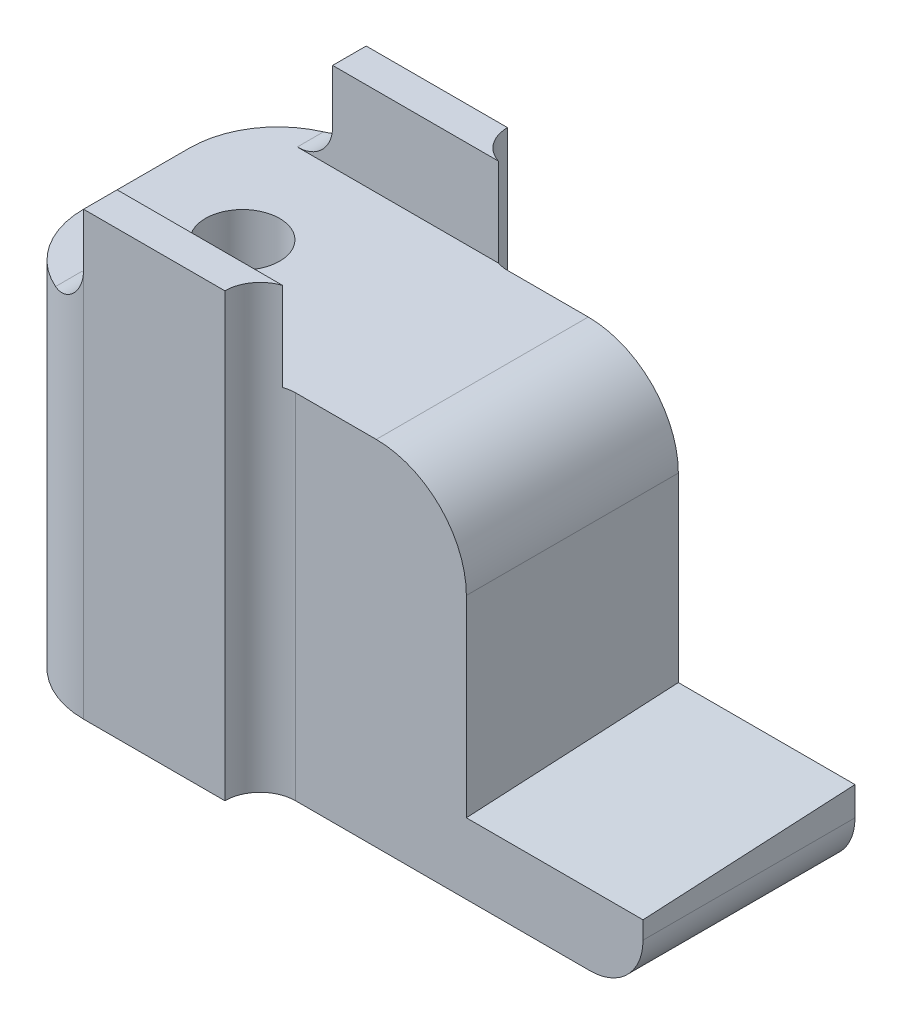
from build123d import *

# Parameters (mm, degrees)
SKETCH1_W           = 12
SKETCH1_H           = 16
SKETCH1_R           = 2.1
SKETCH1_W_2         = 1
BOSS_EXTRUDE1_DEPTH = 20
FILLET1_R           = 5
SKETCH2_W           = 8
SKETCH2_H           = 1.9
BOSS_EXTRUDE2_DEPTH = 5
SKETCH4_W           = 12
SKETCH4_H           = 20
BOSS_EXTRUDE3_DEPTH = 11.67
FILLET2_R           = 5.1
FILLET4_R           = 2
FILLET6_R           = 2
BOSS_EXTRUDE4_DEPTH = 10
FILLET7_R           = 3


with BuildPart() as part:
    # Sketch1 → Boss-Extrude1 (new body)
    # profile 1 of 2: a face of its own
    with BuildSketch(Plane(origin=(0, 0, 0), x_dir=(1, 0, 0), z_dir=(0, 1, 0))):
        Rectangle(SKETCH1_W, SKETCH1_H)
        with Locations(Location((0, 0, 0), (0, 0, 270))):
            Circle(SKETCH1_R, mode=Mode.SUBTRACT)
    # profile 2 of 2: a face of its own
    with BuildSketch(Plane(origin=(0, 0, 0), x_dir=(1, 0, 0), z_dir=(0, 1, 0))):
        with Locations((6.5, 0)):
            Rectangle(SKETCH1_W_2, SKETCH1_H)
    extrude(amount=BOSS_EXTRUDE1_DEPTH)

    # Fillet1
    fillet1_edges = [part.edges().sort_by_distance(p)[0] for p in [
        (-6, 10, 8),
        (-6, 10, -8),
    ]]
    fillet(fillet1_edges, radius=FILLET1_R)

    # Sketch2 → Boss-Extrude2 (add)
    with BuildSketch(Plane(origin=(0, 20, 0), x_dir=(1, 0, 0), z_dir=(0, 1, 0))):
        with Locations((3, 7.05)):
            Rectangle(SKETCH2_W, SKETCH2_H)
        with Locations((3, -7.05)):
            Rectangle(SKETCH2_W, SKETCH2_H)
    extrude(amount=BOSS_EXTRUDE2_DEPTH)

    # Sketch4 → Boss-Extrude3 (add)
    with BuildSketch(Plane(origin=(7, 0, 0), x_dir=(0, 0, -1), z_dir=(1, 0, 0))):
        with Locations((0, 10)):
            Rectangle(SKETCH4_W, SKETCH4_H)
    extrude(amount=BOSS_EXTRUDE3_DEPTH)

    # Fillet2
    fillet2_edges = [part.edges().sort_by_distance(p)[0] for p in [
        (18.67, 20, 0),
    ]]
    fillet(fillet2_edges, radius=FILLET2_R)

    # Fillet4
    fillet4_edges = [part.edges().sort_by_distance(p)[0] for p in [
        (-1, 20, -7.05),
        (-1, 20, 7.05),
    ]]
    fillet(fillet4_edges, radius=FILLET4_R)

    # Fillet6
    fillet6_edges = [part.edges().sort_by_distance(p)[0] for p in [
        (7, 10, -6),
        (7, 10, 6),
    ]]
    fillet(fillet6_edges, radius=FILLET6_R - 0.0001)  # a hair under: the kernel refuses the full size

    # Sketch5 → Boss-Extrude4 (add)
    with BuildSketch(Plane(origin=(18.67, 0, 0), x_dir=(0, 0, -1), z_dir=(1, 0, 0))):
        Polygon((-6, 4), (6, 4.628893351), (6, 0), (-6, 0), align=None)
    extrude(amount=BOSS_EXTRUDE4_DEPTH)

    # Fillet7
    fillet7_edges = [part.edges().sort_by_distance(p)[0] for p in [
        (28.67, 0, 0),
    ]]
    fillet(fillet7_edges, radius=FILLET7_R)


solid = part.part
